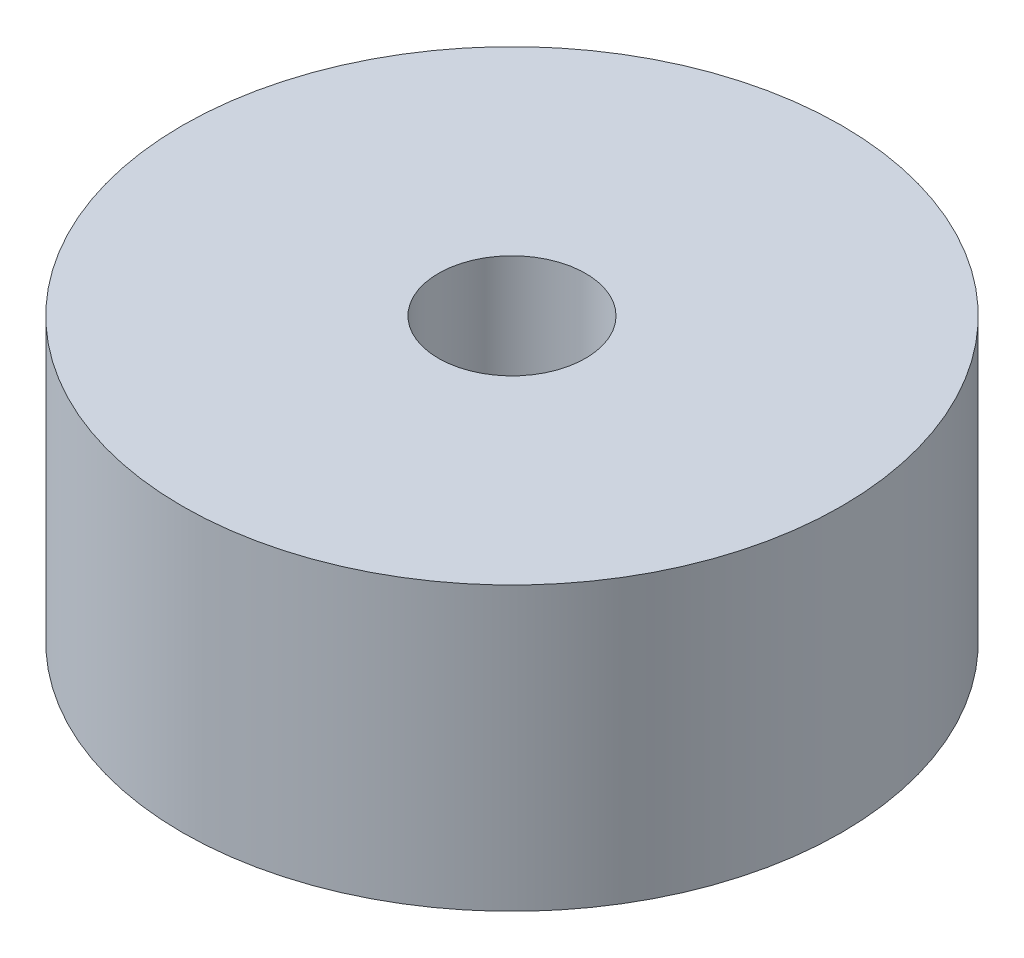
from build123d import *

# Parameters (mm, degrees)
SKETCH_1_R      = 5.6
SKETCH_1_R_2    = 1.25
EXTRUDE_1_DEPTH = 4.8


with BuildPart() as part:
    # 草图1 → 凸台-拉伸1 (new body)
    with BuildSketch(Plane(origin=(0, 0, 0), x_dir=(1, 0, 0), z_dir=(0, 1, 0))):
        Circle(SKETCH_1_R)
        Circle(SKETCH_1_R_2, mode=Mode.SUBTRACT)
    extrude(amount=EXTRUDE_1_DEPTH)


solid = part.part
